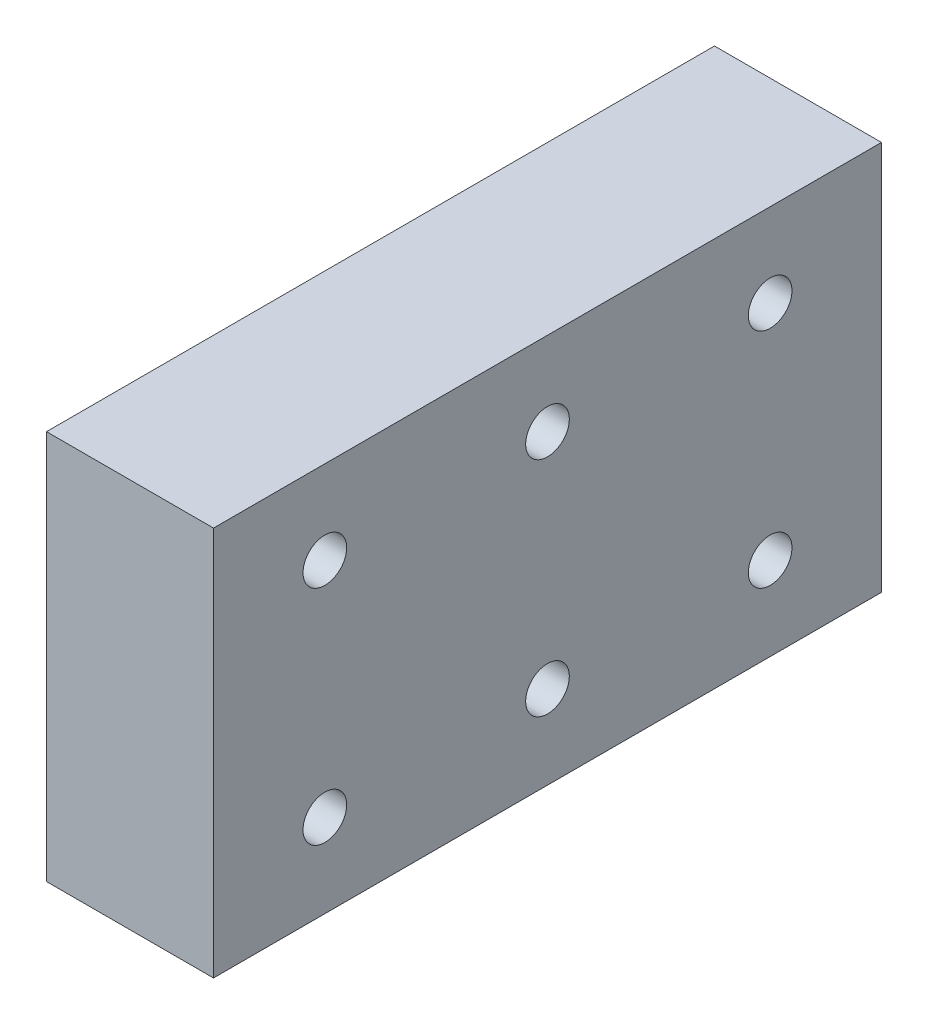
from build123d import *

# Parameters (mm, degrees)
SKETCH1_W           = 19.05
SKETCH1_H           = 44.45
BOSS_EXTRUDE1_DEPTH = 76.2
SKETCH2_R           = 2.4892
CUT_EXTRUDE1_DEPTH  = 91.250457063


with BuildPart() as part:
    # Sketch1 → Boss-Extrude1 (new body)
    with BuildSketch(Plane.XY):
        with Locations((9.525, 22.225)):
            Rectangle(SKETCH1_W, SKETCH1_H)
    extrude(amount=BOSS_EXTRUDE1_DEPTH)

    # Sketch2 → Cut-Extrude1 (cut, through all)
    with BuildSketch(Plane(origin=(19.05, 0, 0), x_dir=(0, 0, -1), z_dir=(1, 0, 0))):
        with Locations((-63.5, 9.525)):
            Circle(SKETCH2_R)
        with Locations((-38.1, 9.525)):
            Circle(SKETCH2_R)
        with Locations((-12.7, 9.525)):
            Circle(SKETCH2_R)
        with Locations((-63.5, 34.925)):
            Circle(SKETCH2_R)
        with Locations((-38.1, 34.925)):
            Circle(SKETCH2_R)
        with Locations((-12.7, 34.925)):
            Circle(SKETCH2_R)
    extrude(amount=-CUT_EXTRUDE1_DEPTH, mode=Mode.SUBTRACT)


solid = part.part
